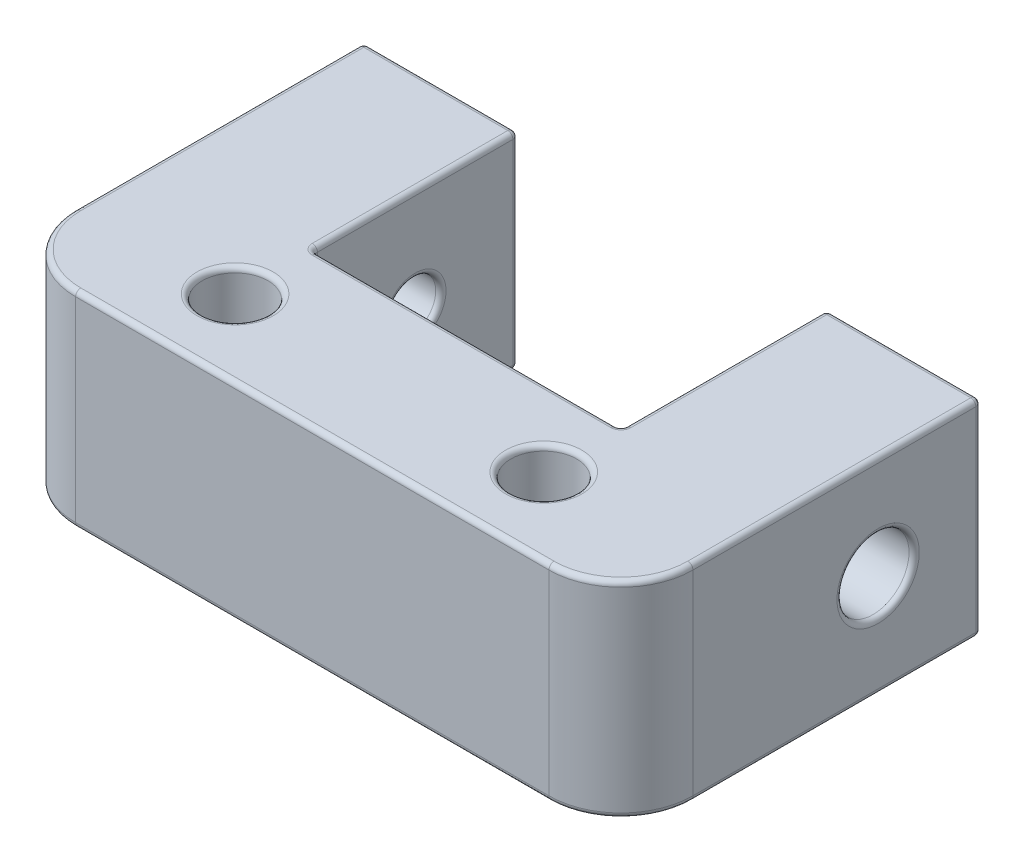
from build123d import *
from build123d.topology import SkipClean

# Parameters (mm, degrees)
SKETCH1_R           = 3.2
BOSS_EXTRUDE1_DEPTH = 20
SKETCH2_R           = 2.5
CUT_EXTRUDE1_DEPTH  = 70
FILLET1_R           = 0.5
SKETCH4_R           = 3.5
CUT_EXTRUDE2_DEPTH  = 10
CUT_EXTRUDE3_DEPTH  = 10
FILLET2_R           = 0.5


with BuildPart() as part:
    # Sketch1 → Boss-Extrude1 (new body)
    # profile 1 of 2: a face of its own
    with SkipClean():  # the faces are left unmerged after this step: merging them gives an invalid solid
        with BuildSketch(Plane(origin=(0, 0, 0), x_dir=(1, 0, 0), z_dir=(0, 1, 0))):
            with BuildLine():
                Line((-30, 12.5), (-30, -12.5))
                Line((-30, -12.5), (-16.997498436, -12.5))
                ThreePointArc((-16.997498436, -12.5), (-15, -11.8), (-13.002501564, -12.5))
                Line((-13.002501564, -12.5), (13.002501564, -12.5))
                ThreePointArc((13.002501564, -12.5), (15, -11.8), (16.997498436, -12.5))
                Line((16.997498436, -12.5), (30, -12.5))
                Line((30, -12.5), (30, 12.5))
                Line((30, 12.5), (15, 12.5))
                Line((15, 12.5), (15, -7.5))
                Line((15, -7.5), (-15, -7.5))
                Line((-15, -7.5), (-15, 12.5))
                Line((-15, 12.5), (-30, 12.5))
            make_face()
        # profile 2 of 2: a face of its own
        with BuildSketch(Plane(origin=(0, 0, 0), x_dir=(1, 0, 0), z_dir=(0, 1, 0))):
            with BuildLine():
                Line((-30, -12.5), (-30, -15.5))
                ThreePointArc((-30, -15.5), (-27.949747468, -20.449747468), (-23, -22.5))
                Line((-23, -22.5), (23, -22.5))
                ThreePointArc((23, -22.5), (27.949747468, -20.449747468), (30, -15.5))
                Line((30, -15.5), (30, -12.5))
                Line((30, -12.5), (-30, -12.5))
            make_face()
            with Locations(Location((15, -15, 0), (0, 0, 90))):
                Circle(SKETCH1_R, mode=Mode.SUBTRACT)
            with Locations(Location((-15, -15, 0), (0, 0, 90))):
                Circle(SKETCH1_R, mode=Mode.SUBTRACT)
        extrude(amount=BOSS_EXTRUDE1_DEPTH)

    # Sketch2 → Cut-Extrude1 (cut)
    with SkipClean():  # the faces are left unmerged after this step: merging them gives an invalid solid
        with BuildSketch(Plane.ZY.offset(30)):
            with Locations((-2.5, 10)):
                Circle(SKETCH2_R)
        extrude(amount=-CUT_EXTRUDE1_DEPTH, mode=Mode.SUBTRACT)

    # Fillet1
    fillet1_edges = [part.edges().sort_by_distance(p)[0] for p in [
        (27.949747468, 20, 20.449747468),
        (-15, 0, 18.2),
        (0, 0, 22.5),
        (-27.949747468, 0, 20.449747468),
        (-30, 0, 0),
        (-22.5, 0, -12.5),
        (-15, 0, -2.5),
        (0, 0, 7.5),
        (30, 20, 0),
        (15, 0, -2.5),
        (22.5, 0, -12.5),
        (30, 0, 0),
        (27.949747468, 0, 20.449747468),
        (15, 0, 18.2),
        (-30, 10, -12.5),
        (-15, 10, -12.5),
        (-15, 10, 7.5),
        (15, 10, 7.5),
        (15, 10, -12.5),
        (22.5, 20, -12.5),
        (30, 10, -12.5),
        (15, 20, -2.5),
        (0, 20, 7.5),
        (-15, 20, -2.5),
        (15, 10, -5),
        (30, 10, -5),
        (-15, 10, -5),
        (-30, 10, -5),
        (-22.5, 20, -12.5),
        (-30, 20, 0),
        (-27.949747468, 20, 20.449747468),
        (0, 20, 22.5),
        (-15, 20, 18.2),
        (15, 20, 18.2),
    ]]
    fillet(fillet1_edges, radius=FILLET1_R)

    # Sketch4 → Cut-Extrude2 (cut)
    with BuildSketch(Plane(origin=(30, 0, 0), x_dir=(0, 0, -1), z_dir=(1, 0, 0))):
        with Locations((2.5, 10)):
            Circle(SKETCH4_R)
    extrude(amount=-CUT_EXTRUDE2_DEPTH, mode=Mode.SUBTRACT)

    # Sketch3 → Cut-Extrude3 (cut)
    with BuildSketch(Plane.ZY.offset(30)):
        Polygon((2.696152423, 10), (0.098076211, 14.5), (-5.098076211, 14.5), (-7.696152423, 10), (-5.098076211, 5.5), (0.098076211, 5.5), align=None)
    extrude(amount=-CUT_EXTRUDE3_DEPTH, mode=Mode.SUBTRACT)

    # Fillet2
    fillet2_edges = [part.edges().sort_by_distance(p)[0] for p in [
        (20, 10, 1),
        (20, 10, -5),
        (30, 10, 1),
        (-30, 7.75, 1.397114317),
        (-30, 12.25, 1.397114317),
        (-30, 14.5, -2.5),
        (-30, 12.25, -6.397114317),
        (-30, 7.75, -6.397114317),
        (-30, 5.5, -2.5),
    ]]
    fillet(fillet2_edges, radius=FILLET2_R - 0.0001)  # a hair under: the kernel refuses the full size


solid = part.part
